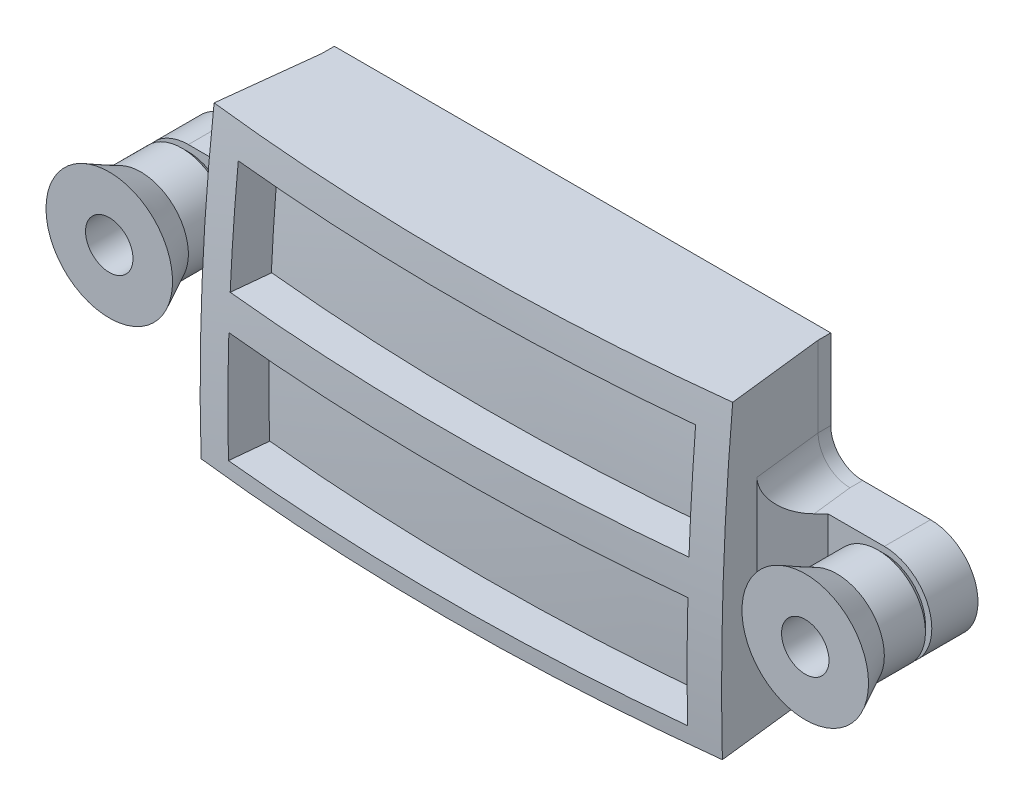
from build123d import *
from OCP.BRepFilletAPI import BRepFilletAPI_MakeChamfer

# Parameters (mm, degrees)
REVOLVE1_ANGLE          = 13.104621076
CUT_REVOLVE1_ANGLE      = 11.534873692
REVOLVE4_ANGLE          = 11.464873692
CUT_EXTRUDE2_START      = -15.691444559
CUT_EXTRUDE2_OUTLINE_W  = 22.613004813
CUT_EXTRUDE2_OUTLINE_H  = 19.16
CUT_EXTRUDE2_DEPTH      = 31.382889118
BOSS_EXTRUDE3_OUTLINE_R = 1.25
BOSS_EXTRUDE3_DEPTH     = 2.120878311
FILLET1_R               = 2
CHAMFER2_SIZE           = 2.5
CHAMFER2_SIZE2          = 2.257176605
SKETCH11_R              = 2.15
BOSS_EXTRUDE4_DEPTH     = 0.8
CUT_EXTRUDE5_START      = -0.4
CUT_EXTRUDE5_DEPTH      = 0.4
CUT_EXTRUDE6_START      = 136.613004813
CUT_EXTRUDE6_DEPTH      = 0.2
SKETCH13_W              = 5.1
SKETCH13_H              = 5.1
CUT_EXTRUDE7_DEPTH      = 0.8


# Read off the part's stored shape, not the designer's step: Cut-Extrude2, Boss-Extrude3, Cut-Extrude6
with BuildPart() as part:
    # Sketch2 → Revolve1 (revolve, symmetric)
    with BuildSketch(Plane(origin=(0, 0, 0), x_dir=(0, 0, -1), z_dir=(1, 0, 0))) as revolve1_sk:
        with BuildLine():
            Line((-144.394606894, 1), (-116.613004813, 1))
            Line((-116.613004813, 1), (-116.613004813, 20.16))
            Line((-116.613004813, 20.16), (-143.65227774, 20.16))
            ThreePointArc((-143.65227774, 20.16), (-144.341706852, 10.592330743), (-144.394606894, 1))
        make_face()
    revolve(axis=Axis((0, 110.183531328, 0), (0, -1, 0)), revolution_arc=REVOLVE1_ANGLE / 2)
    revolve(revolve1_sk.sketch, axis=Axis((0, 110.183531328, 0), (0, 1, 0)), revolution_arc=REVOLVE1_ANGLE / 2)

    # Sketch2<3> → Cut-Revolve1 (revolve, symmetric, cut)
    with BuildSketch(Plane(origin=(0, 0, 0), x_dir=(0, 0, -1), z_dir=(1, 0, 0))) as cut_revolve1_sk:
        with BuildLine():
            ThreePointArc((-143.849285365, 18.16), (-144.126109058, 14.667842971), (-144.318167948, 11.17))
            Line((-144.318167948, 11.17), (-137.31303574, 11.17))
            ThreePointArc((-137.31303574, 11.17), (-137.111143693, 14.668141466), (-136.820148677, 18.16))
            Line((-136.820148677, 18.16), (-143.849285365, 18.16))
        make_face()
        with BuildLine():
            ThreePointArc((-144.394606894, 9), (-144.449134138, 5.500146838), (-144.418843992, 2))
            Line((-144.418843992, 2), (-137.418843992, 2))
            ThreePointArc((-137.418843992, 2), (-137.450676688, 5.500162179), (-137.393372053, 9))
            Line((-137.393372053, 9), (-144.394606894, 9))
        make_face()
        with BuildLine():
            ThreePointArc((-136.820148677, 18.16), (-137.111143693, 14.668141466), (-137.31303574, 11.17))
            Line((-137.31303574, 11.17), (-136.613004813, 11.17))
            Line((-136.613004813, 11.17), (-136.613004813, 18.16))
            Line((-136.613004813, 18.16), (-136.820148677, 18.16))
        make_face()
        with BuildLine():
            ThreePointArc((-137.393372053, 9), (-137.450676688, 5.500162179), (-137.418843992, 2))
            Line((-137.418843992, 2), (-136.613004813, 2))
            Line((-136.613004813, 2), (-136.613004813, 9))
            Line((-136.613004813, 9), (-137.393372053, 9))
        make_face()
    revolve(axis=Axis((0, 110.183531328, 0), (0, -1, 0)), revolution_arc=CUT_REVOLVE1_ANGLE / 2, mode=Mode.SUBTRACT)
    revolve(cut_revolve1_sk.sketch, axis=Axis((0, 110.183531328, 0), (0, 1, 0)), revolution_arc=CUT_REVOLVE1_ANGLE / 2, mode=Mode.SUBTRACT)


with BuildPart() as body_2:
    # Sketch10 → Revolve4 (revolve, symmetric)
    with BuildSketch(Plane(origin=(0, 0, 0), x_dir=(0, 0, -1), z_dir=(1, 0, 0))) as revolve4_sk:
        with BuildLine():
            Line((-136.713004813, 18.06), (-141.548786289, 18.06))
            ThreePointArc((-141.548786289, 18.06), (-141.820861348, 14.667770498), (-142.011653043, 11.27))
            Line((-142.011653043, 11.27), (-136.713004813, 11.27))
            Line((-136.713004813, 11.27), (-136.713004813, 18.06))
        make_face()
        with BuildLine():
            Line((-136.713004813, 8.9), (-142.096490104, 8.9))
            ThreePointArc((-142.096490104, 8.9), (-142.149120141, 5.500143086), (-142.120415493, 2.1))
            Line((-142.120415493, 2.1), (-136.713004813, 2.1))
            Line((-136.713004813, 2.1), (-136.713004813, 8.9))
        make_face()
    revolve(axis=Axis((0, 90.486530569, 0), (0, -1, 0)), revolution_arc=REVOLVE4_ANGLE / 2)
    revolve(revolve4_sk.sketch, axis=Axis((0, 90.486530569, 0), (0, 1, 0)), revolution_arc=REVOLVE4_ANGLE / 2)


with BuildPart() as cut_extrude2_tool:
    # Cut-Extrude2 outline → Cut-Extrude2 (new body)
    with BuildSketch(Plane(origin=(0, 0, 0), x_dir=(0, 0, -1), z_dir=(1, 0, 0)).offset(CUT_EXTRUDE2_START)):
        with Locations((-125.306502407, 10.58)):
            Rectangle(CUT_EXTRUDE2_OUTLINE_W, CUT_EXTRUDE2_OUTLINE_H)
    extrude(amount=CUT_EXTRUDE2_DEPTH)


with BuildPart() as part_1:
    add(part.part)

    # Cut-Extrude2: cut by cut_extrude2_tool
    add(cut_extrude2_tool.part, mode=Mode.SUBTRACT)

    # Boss-Extrude3 outline → Boss-Extrude3 (add)
    with BuildSketch(Plane(origin=(0, 0, 138.733883125), x_dir=(-1, 0, 0), z_dir=(0, 0, -1))):
        with BuildLine():
            Line((22, 13.085), (15.691444559, 13.085))
            Line((15.691444559, 13.085), (15.691444559, 7.085))
            Line((15.691444559, 7.085), (22, 7.085))
            ThreePointArc((22, 7.085), (25, 10.085), (22, 13.085))
        make_face()
        with Locations((22, 10.085)):
            Circle(BOSS_EXTRUDE3_OUTLINE_R, mode=Mode.SUBTRACT)
    boss_extrude3 = extrude(amount=BOSS_EXTRUDE3_DEPTH)

    # Mirror7: Boss-Extrude3 across plane
    add(boss_extrude3.mirror(Plane(origin=(0, 0, 0), x_dir=(0, 0, 1), z_dir=(1, 0, 0))))

    # Fillet1
    fillet1_edges = [part_1.edges().sort_by_distance(p)[0] for p in [
        (-15.813247182, 13.085, 137.673443969),
        (-15.813247182, 7.085, 137.673443969),
        (15.813247182, 13.085, 137.673443969),
        (15.813247182, 7.085, 137.673443969),
    ]]
    fillet(fillet1_edges, radius=FILLET1_R)

    # Chamfer2: one chamfer whose edges measure the first distance from different faces: ONE call of the kernel's chamfer builder (chamfer() names one face for all edges)
    chamfer2_edges_1 = [part_1.edges().sort_by_distance(p)[0] for p in [
        (-15.935049804, 10.085, 138.733883125),
    ]]
    chamfer2_side_1 = [part_1.faces().sort_by_distance(p)[0] for p in [
        (-16.127692214, 10.467235717, 140.411068316),
    ]]
    chamfer2_edges_2 = [part_1.edges().sort_by_distance(p)[0] for p in [
        (15.935049804, 10.085, 138.733883125),
    ]]
    chamfer2_side_2 = [part_1.faces().sort_by_distance(p)[0] for p in [
        (19.844503511, 10.085, 138.733883125),
    ]]
    chamfer2 = BRepFilletAPI_MakeChamfer(part_1.part.solid().wrapped)
    for e in chamfer2_edges_1:
        chamfer2.Add(CHAMFER2_SIZE, CHAMFER2_SIZE2, e.wrapped, chamfer2_side_1[0].wrapped)  # the first distance lies on this face
    for e in chamfer2_edges_2:
        chamfer2.Add(CHAMFER2_SIZE, CHAMFER2_SIZE2, e.wrapped, chamfer2_side_2[0].wrapped)  # the first distance lies on this face
    add(Compound.cast(chamfer2.Shape()), mode=Mode.REPLACE)

    # Sketch11 → Boss-Extrude4 (add)
    with BuildSketch(Plane(origin=(0, 0, 136.613004813), x_dir=(-1, 0, 0), z_dir=(0, 0, -1))):
        with BuildLine():
            Line((15.691444559, 20.16), (-15.691444559, 20.16))
            Line((-15.691444559, 20.16), (-15.691444559, 15.085))
            add(Edge.make_bspline(
                [(-17.704594276, 13.085), (-15.691444559, 13.085), (-15.691444559, 15.085)],
                knots=[4.71238898, 4.71238898, 4.71238898, 6.283185307, 6.283185307, 6.283185307], degree=2, weights=[1, 0.707106781, 1]))
            Line((-17.704594276, 13.085), (-22, 13.085))
            ThreePointArc((-22, 13.085), (-25, 10.085), (-22, 7.085))
            Line((-22, 7.085), (-17.704594276, 7.085))
            add(Edge.make_bspline(
                [(-15.691444559, 5.085), (-15.691444559, 7.085), (-17.704594276, 7.085)],
                knots=[3.141592654, 3.141592654, 3.141592654, 4.71238898, 4.71238898, 4.71238898], degree=2, weights=[1, 0.707106781, 1]))
            Line((-15.691444559, 5.085), (-15.691444559, 1))
            Line((-15.691444559, 1), (15.691444559, 1))
            Line((15.691444559, 1), (15.691444559, 5.085))
            add(Edge.make_bspline(
                [(17.704594276, 7.085), (15.691444559, 7.085), (15.691444559, 5.085)],
                knots=[4.71238898, 4.71238898, 4.71238898, 6.283185307, 6.283185307, 6.283185307], degree=2, weights=[1, 0.707106781, 1]))
            Line((17.704594276, 7.085), (22, 7.085))
            ThreePointArc((22, 7.085), (25, 10.085), (22, 13.085))
            Line((22, 13.085), (17.704594276, 13.085))
            add(Edge.make_bspline(
                [(15.691444559, 15.085), (15.691444559, 13.085), (17.704594276, 13.085)],
                knots=[3.141592654, 3.141592654, 3.141592654, 4.71238898, 4.71238898, 4.71238898], degree=2, weights=[1, 0.707106781, 1]))
            Line((15.691444559, 15.085), (15.691444559, 20.16))
        make_face()
        with Locations((-22, 10.085)):
            Circle(SKETCH11_R, mode=Mode.SUBTRACT)
        with Locations((22, 10.085)):
            Circle(SKETCH11_R, mode=Mode.SUBTRACT)
    extrude(amount=BOSS_EXTRUDE4_DEPTH)

    # Sketch12 → Cut-Extrude5 (cut)
    with BuildSketch(Plane(origin=(0, 0, 136.613004813), x_dir=(-1, 0, 0), z_dir=(0, 0, -1)).offset(CUT_EXTRUDE5_START)):
        with BuildLine():
            ThreePointArc((20.75, 10.085), (21.116116524, 10.968883476), (22, 11.335))
            Line((22, 11.335), (20.75, 11.335))
            Line((20.75, 11.335), (20.75, 10.085))
        make_face()
        with BuildLine():
            Line((23.25, 10.085), (23.25, 11.335))
            Line((23.25, 11.335), (22, 11.335))
            ThreePointArc((22, 11.335), (22.883883476, 10.968883476), (23.25, 10.085))
        make_face()
        with BuildLine():
            Line((23.25, 8.835), (23.25, 10.085))
            ThreePointArc((23.25, 10.085), (22.883883476, 9.201116524), (22, 8.835))
            Line((22, 8.835), (23.25, 8.835))
        make_face()
        with BuildLine():
            Line((20.75, 8.835), (22, 8.835))
            ThreePointArc((22, 8.835), (21.116116524, 9.201116524), (20.75, 10.085))
            Line((20.75, 10.085), (20.75, 8.835))
        make_face()
    cut_extrude5 = extrude(amount=CUT_EXTRUDE5_DEPTH, mode=Mode.SUBTRACT)

    # Cut-Extrude6 outline → Cut-Extrude6 (cut)
    with BuildSketch(Plane.XY.offset(CUT_EXTRUDE6_START)):
        with BuildLine():
            Line((-20.75, 11.335), (-20.75, 11.834285568))
            ThreePointArc((-20.75, 11.834285568), (-22, 12.235), (-23.25, 11.834285568))
            Line((-23.25, 11.834285568), (-23.25, 11.335))
            Line((-23.25, 11.335), (-20.75, 11.335))
        make_face()
        with BuildLine():
            ThreePointArc((-23.25, 8.335714432), (-22, 7.935), (-20.75, 8.335714432))
            Line((-20.75, 8.335714432), (-20.75, 8.835))
            Line((-20.75, 8.835), (-23.25, 8.835))
            Line((-23.25, 8.835), (-23.25, 8.335714432))
        make_face()
    cut_extrude6 = extrude(amount=CUT_EXTRUDE6_DEPTH, mode=Mode.SUBTRACT)

    # Mirror12: Cut-Extrude5, Cut-Extrude6, Cut-Extrude6 across plane
    add(cut_extrude5.mirror(Plane(origin=(0, 0, 0), x_dir=(0, 0, 1), z_dir=(1, 0, 0))), mode=Mode.SUBTRACT)
    add(cut_extrude6.mirror(Plane(origin=(0, 0, 0), x_dir=(0, 0, 1), z_dir=(1, 0, 0))), mode=Mode.SUBTRACT)
    add(cut_extrude6.mirror(Plane(origin=(0, 0, 0), x_dir=(0, 0, 1), z_dir=(1, 0, 0))), mode=Mode.SUBTRACT)

    # Sketch13 → Cut-Extrude7 (cut)
    with BuildSketch(Plane(origin=(0, 0, 136.613004813), x_dir=(-1, 0, 0), z_dir=(0, 0, -1))):
        with Locations((-10.875, 14.665)):
            Rectangle(SKETCH13_W, SKETCH13_H)
        with Locations((-10.875, 5.5)):
            Rectangle(SKETCH13_W, SKETCH13_H)
        with Locations((-3.625, 5.5)):
            Rectangle(SKETCH13_W, SKETCH13_H)
        with Locations((-3.625, 14.665)):
            Rectangle(SKETCH13_W, SKETCH13_H)
        with Locations((3.625, 14.665)):
            Rectangle(SKETCH13_W, SKETCH13_H)
        with Locations((10.875, 14.665)):
            Rectangle(SKETCH13_W, SKETCH13_H)
        with Locations((10.875, 5.5)):
            Rectangle(SKETCH13_W, SKETCH13_H)
        with Locations((3.625, 5.5)):
            Rectangle(SKETCH13_W, SKETCH13_H)
    extrude(amount=CUT_EXTRUDE7_DEPTH, mode=Mode.SUBTRACT)


with BuildPart() as body_2_1:
    add(body_2.part)

    # Cut-Extrude2: cut by cut_extrude2_tool
    add(cut_extrude2_tool.part, mode=Mode.SUBTRACT)


with BuildPart() as body_3:
    # Sketch6 → Revolve3 (revolve)
    with BuildSketch(Plane(origin=(0, 10.085, 0), x_dir=(1, 0, 0), z_dir=(0, 1, 0)), mode=Mode.PRIVATE) as revolve3_sk:
        Polygon((-20.5, -138.733883125), (-19.4, -138.733883125), (-19, -139.133883125), (-19, -141.733883125), (-18, -143.733883125), (-20.5, -143.733883125), align=None)
    revolve(revolve3_sk.sketch.rotate(Axis((-22, 10.085, 109.761224365), (0, 0, 1)), 180), axis=Axis((-22, 10.085, 109.761224365), (0, 0, 1)))


with BuildPart() as body_4:
    # Mirror11: mirrored copy
    add(body_3.part.mirror(Plane(origin=(0, 0, 0), x_dir=(0, 0, 1), z_dir=(1, 0, 0))))


solid = Compound([part_1.part, body_2_1.part, body_3.part, body_4.part])
